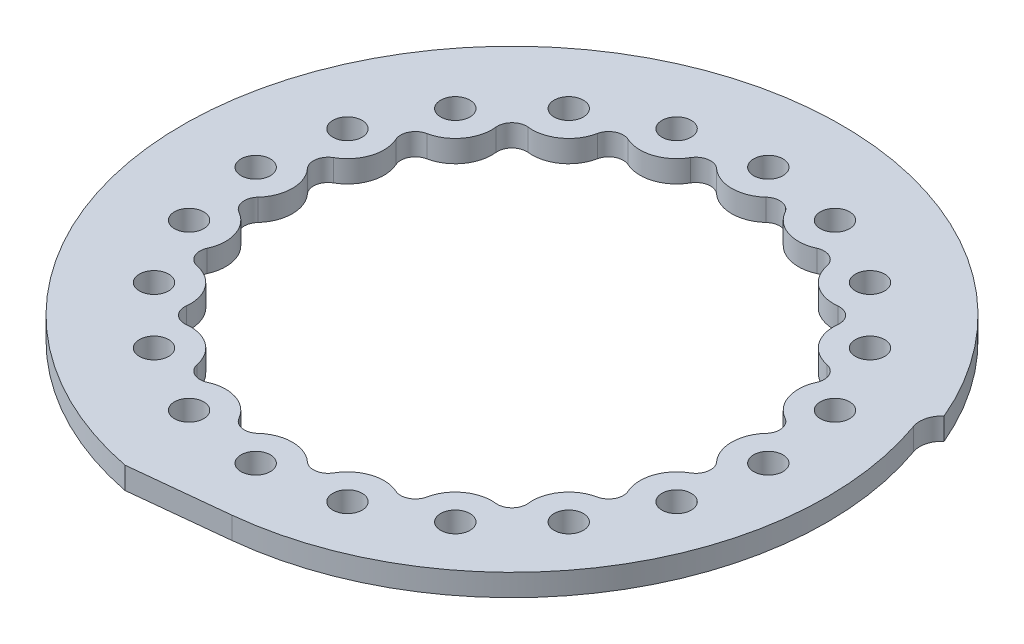
from build123d import *

# Parameters (mm, degrees)
SKETCH1_R           = 102.5
SKETCH1_R_2         = 60
BOSS_EXTRUDE1_DEPTH = 6
SKETCH2_R           = 4
CUT_EXTRUDE1_DEPTH  = 146.081011852
CIRPATTERN1_COUNT   = 20
SKETCH4_OUTSIDE_W   = 264.996
SKETCH4_OUTSIDE_H   = 264.996
SKETCH4_OUTSIDE_R   = 86
CUT_EXTRUDE3_DEPTH  = 146.081011852
CUT_EXTRUDE4_DEPTH  = 10
BOSS_EXTRUDE2_DEPTH = 6
FILLET1_R           = 6


with BuildPart() as part:
    # Sketch1 → Boss-Extrude1 (new body)
    with BuildSketch(Plane(origin=(0, 0, 0), x_dir=(1, 0, 0), z_dir=(0, 1, 0))):
        with Locations(Location((0, 0, 0), (0, 0, 270))):
            Circle(SKETCH1_R)
        with Locations(Location((0, 0, 0), (0, 0, 270))):
            Circle(SKETCH1_R_2, mode=Mode.SUBTRACT)
    extrude(amount=BOSS_EXTRUDE1_DEPTH)

    # Sketch2 → Cut-Extrude1 (cut, through all)
    with BuildSketch(Plane(origin=(0, 6, 0), x_dir=(1, 0, 0), z_dir=(0, 1, 0))):
        with Locations(Location((0, 70, 0), (0, 0, 270))):
            Circle(SKETCH2_R)
    cut_extrude1 = extrude(amount=-CUT_EXTRUDE1_DEPTH, mode=Mode.SUBTRACT)

    # CirPattern1: Cut-Extrude1 ×20 about axis
    cirpattern1_axis = Axis((0, 0, 0), (0, 1, 0))
    for i in range(1, CIRPATTERN1_COUNT):
        add(cut_extrude1.rotate(cirpattern1_axis, i * 360 / CIRPATTERN1_COUNT), mode=Mode.SUBTRACT)

    # Sketch4 outside → Cut-Extrude3 (cut, through all)
    with BuildSketch(Plane(origin=(0, 6, 0), x_dir=(1, 0, 0), z_dir=(0, 1, 0))):
        Rectangle(SKETCH4_OUTSIDE_W, SKETCH4_OUTSIDE_H)
        with Locations(Location((0, 0, 0), (0, 0, 270))):
            Circle(SKETCH4_OUTSIDE_R, mode=Mode.SUBTRACT)
    extrude(amount=-CUT_EXTRUDE3_DEPTH, mode=Mode.SUBTRACT)

    # Sketch5 → Cut-Extrude4 (cut)
    with BuildSketch(Plane(origin=(0, 6, 0), x_dir=(1, 0, 0), z_dir=(0, 1, 0))):
        with BuildLine():
            ThreePointArc((46.694681279, 42.270046437), (48.541019662, 35.267115138), (54.63065317, 31.347118204))
            ThreePointArc((54.63065317, 31.347118204), (57.394464692, 29.243940421), (57.471443608, 25.771753046))
            ThreePointArc((57.471443608, 25.771753046), (57.063390978, 18.541019662), (61.643630936, 12.931080792))
            ThreePointArc((61.643630936, 12.931080792), (63.622254217, 10.076775126), (62.622500611, 6.750740904))
            ThreePointArc((62.622500611, 6.750740904), (60, 0), (62.622500611, -6.750740904))
            ThreePointArc((62.622500611, -6.750740904), (63.622254217, -10.076775126), (61.643630936, -12.931080792))
            ThreePointArc((61.643630936, -12.931080792), (57.063390978, -18.541019662), (57.471443608, -25.771753046))
            ThreePointArc((57.471443608, -25.771753046), (57.394464692, -29.243940421), (54.63065317, -31.347118204))
            ThreePointArc((54.63065317, -31.347118204), (48.541019662, -35.267115138), (46.694681279, -42.270046437))
            ThreePointArc((46.694681279, -42.270046437), (45.548505072, -45.548505072), (42.270046437, -46.694681279))
            ThreePointArc((42.270046437, -46.694681279), (35.267115138, -48.541019662), (31.347118204, -54.63065317))
            ThreePointArc((31.347118204, -54.63065317), (29.243940421, -57.394464692), (25.771753046, -57.471443608))
            ThreePointArc((25.771753046, -57.471443608), (18.541019662, -57.063390978), (12.931080792, -61.643630936))
            ThreePointArc((12.931080792, -61.643630936), (10.076775126, -63.622254217), (6.750740904, -62.622500611))
            ThreePointArc((6.750740904, -62.622500611), (0, -60), (-6.750740904, -62.622500611))
            ThreePointArc((-6.750740904, -62.622500611), (-10.076775126, -63.622254217), (-12.931080792, -61.643630936))
            ThreePointArc((-12.931080792, -61.643630936), (-18.541019662, -57.063390978), (-25.771753046, -57.471443608))
            ThreePointArc((-25.771753046, -57.471443608), (-29.243940421, -57.394464692), (-31.347118204, -54.63065317))
            ThreePointArc((-31.347118204, -54.63065317), (-35.267115138, -48.541019662), (-42.270046437, -46.694681279))
            ThreePointArc((-42.270046437, -46.694681279), (-45.548505072, -45.548505072), (-46.694681279, -42.270046437))
            ThreePointArc((-46.694681279, -42.270046437), (-48.541019662, -35.267115138), (-54.63065317, -31.347118204))
            ThreePointArc((-54.63065317, -31.347118204), (-57.394464692, -29.243940421), (-57.471443608, -25.771753046))
            ThreePointArc((-57.471443608, -25.771753046), (-57.063390978, -18.541019662), (-61.643630936, -12.931080792))
            ThreePointArc((-61.643630936, -12.931080792), (-63.622254217, -10.076775126), (-62.622500611, -6.750740904))
            ThreePointArc((-62.622500611, -6.750740904), (-60, 0), (-62.622500611, 6.750740904))
            ThreePointArc((-62.622500611, 6.750740904), (-63.622254217, 10.076775126), (-61.643630936, 12.931080792))
            ThreePointArc((-61.643630936, 12.931080792), (-57.063390978, 18.541019662), (-57.471443608, 25.771753046))
            ThreePointArc((-57.471443608, 25.771753046), (-57.394464692, 29.243940421), (-54.63065317, 31.347118204))
            ThreePointArc((-54.63065317, 31.347118204), (-48.541019662, 35.267115138), (-46.694681279, 42.270046437))
            ThreePointArc((-46.694681279, 42.270046437), (-45.548505072, 45.548505072), (-42.270046437, 46.694681279))
            ThreePointArc((-42.270046437, 46.694681279), (-35.267115138, 48.541019662), (-31.347118204, 54.63065317))
            ThreePointArc((-31.347118204, 54.63065317), (-29.243940421, 57.394464692), (-25.771753046, 57.471443608))
            ThreePointArc((-25.771753046, 57.471443608), (-18.541019662, 57.063390978), (-12.931080792, 61.643630936))
            ThreePointArc((-12.931080792, 61.643630936), (-10.076775126, 63.622254217), (-6.750740904, 62.622500611))
            ThreePointArc((-6.750740904, 62.622500611), (0, 60), (6.750740904, 62.622500611))
            ThreePointArc((6.750740904, 62.622500611), (10.076775126, 63.622254217), (12.931080792, 61.643630936))
            ThreePointArc((12.931080792, 61.643630936), (18.541019662, 57.063390978), (25.771753046, 57.471443608))
            ThreePointArc((25.771753046, 57.471443608), (29.243940421, 57.394464692), (31.347118204, 54.63065317))
            ThreePointArc((31.347118204, 54.63065317), (35.267115138, 48.541019662), (42.270046437, 46.694681279))
            ThreePointArc((42.270046437, 46.694681279), (45.548505072, 45.548505072), (46.694681279, 42.270046437))
        make_face()
    extrude(amount=-CUT_EXTRUDE4_DEPTH, mode=Mode.SUBTRACT)

    # Sketch6 → Boss-Extrude2 (add)
    with BuildSketch(Plane(origin=(0, 6, 0), x_dir=(1, 0, 0), z_dir=(0, 1, 0))):
        with BuildLine():
            Line((-17.398199941, -88.302336542), (8.989447841, -85.528883002))
            ThreePointArc((8.989447841, -85.528883002), (-74.100107798, 43.648299215), (79.163417397, 33.60287705))
            Line((79.163417397, 33.60287705), (82.845436811, 35.165801564))
            ThreePointArc((82.845436811, 35.165801564), (-69.870812829, 56.728031119), (-17.398199941, -88.302336542))
        make_face()
    extrude(amount=-BOSS_EXTRUDE2_DEPTH)

    # Fillet1
    # the kernel refuses this fillet: 6 mm, written as the material it adds along each edge
    with BuildSketch(Plane(origin=(79.163417397, 6, -33.60287705), x_dir=(0.36192981714556505, 0, 0.9322053461877259), z_dir=(0, -1, 0))) as fillet1_piece_1:
        with BuildLine():
            CenterArc((5.532861862, -5.997100749), FILLET1_R, 91.781239909, 68.757327573)
            Line((-0.124333974, -3.998067166), (-0.237477891, -3.958086494))
            ThreePointArc((-0.237477891, -3.958086494), (-0.182109002, -1.995303564), (-0.119942015, 0.003730019))
            Line((-0.119942015, 0.003730019), (0.003730019, 0.119942015))
            ThreePointArc((0.003730019, 0.119942015), (2.67318045, 0.078444066), (5.342630881, 0.119942015))
            Line((5.342630881, 0.119942015), (5.346360901, 0))
        make_face()
    extrude(amount=6)


solid = part.part
